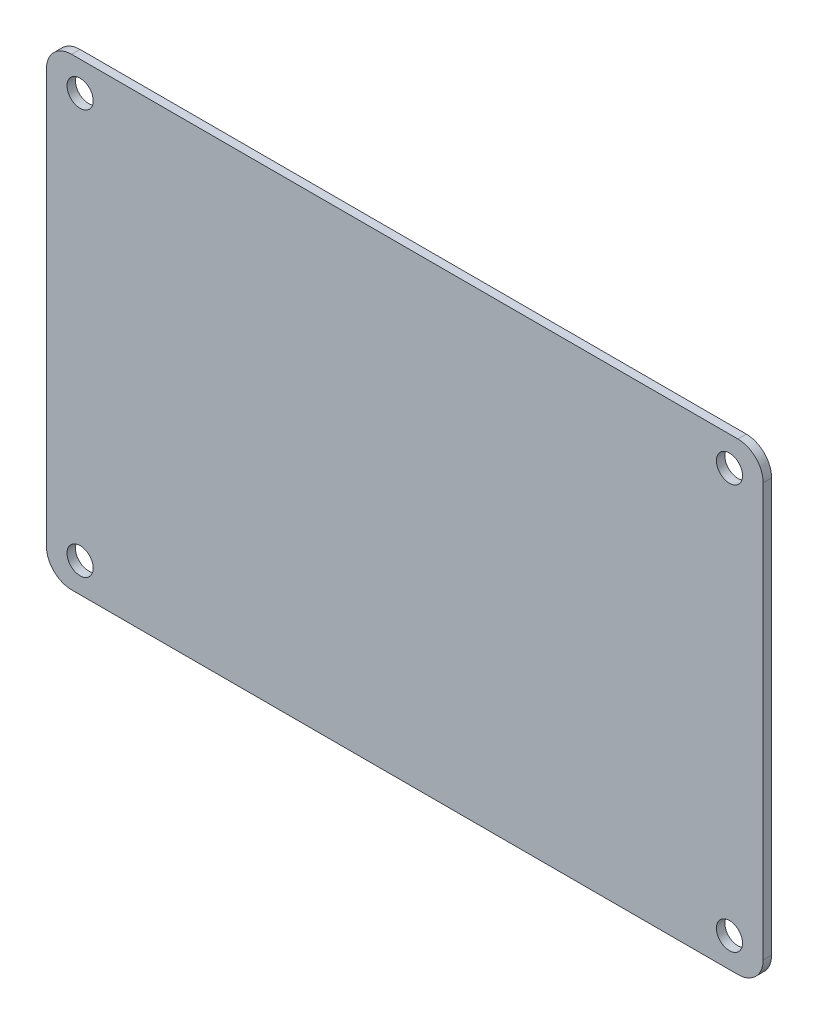
from build123d import *

# Parameters (mm, degrees)
SKETCH1_R           = 1.55
BOSS_EXTRUDE1_DEPTH = 1
CUT_EXTRUDE7_REACH  = 52.631
SKETCH3_R           = 1.55
SKETCH4_R           = 1.55
CUT_EXTRUDE8_DEPTH  = 51.631018161
SKETCH7_R           = 1.55
CUT_EXTRUDE9_DEPTH  = 51.631018161


with BuildPart() as part:
    # Sketch1 → Boss-Extrude1 (new body)
    with BuildSketch(Plane.XY):
        with BuildLine():
            Line((-39.5, 27.5), (39.5, 27.5))
            ThreePointArc((39.5, 27.5), (41.621320344, 26.621320344), (42.5, 24.5))
            Line((42.5, 24.5), (42.5, -24.5))
            ThreePointArc((42.5, -24.5), (41.621320344, -26.621320344), (39.5, -27.5))
            Line((39.5, -27.5), (-39.5, -27.5))
            ThreePointArc((-39.5, -27.5), (-41.621320344, -26.621320344), (-42.5, -24.5))
            Line((-42.5, -24.5), (-42.5, 24.5))
            ThreePointArc((-42.5, 24.5), (-41.621320344, 26.621320344), (-39.5, 27.5))
        make_face()
        with Locations((-38.5, -24)):
            Circle(SKETCH1_R, mode=Mode.SUBTRACT)
    extrude(amount=BOSS_EXTRUDE1_DEPTH)

    # Sketch3 → Cut-Extrude7 (cut, up to next)
    with BuildSketch(Plane.XY, mode=Mode.PRIVATE) as cut_extrude7_sk1:
        with Locations((38.5, -24)):
            Circle(SKETCH3_R)
    cut_extrude7_tool1 = extrude(cut_extrude7_sk1.sketch, amount=CUT_EXTRUDE7_REACH, mode=Mode.PRIVATE) & part.part
    add(cut_extrude7_tool1.solids().sort_by_distance((38.5, -24, 0))[0], mode=Mode.SUBTRACT)

    # Sketch4 → Cut-Extrude8 (cut, through all)
    with BuildSketch(Plane.XY.offset(1)):
        with Locations((-38.5, 24)):
            Circle(SKETCH4_R)
    extrude(amount=-CUT_EXTRUDE8_DEPTH, mode=Mode.SUBTRACT)

    # Sketch7 → Cut-Extrude9 (cut, through all)
    with BuildSketch(Plane.XY.offset(1)):
        with Locations((38.5, 24)):
            Circle(SKETCH7_R)
    extrude(amount=-CUT_EXTRUDE9_DEPTH, mode=Mode.SUBTRACT)


solid = part.part
